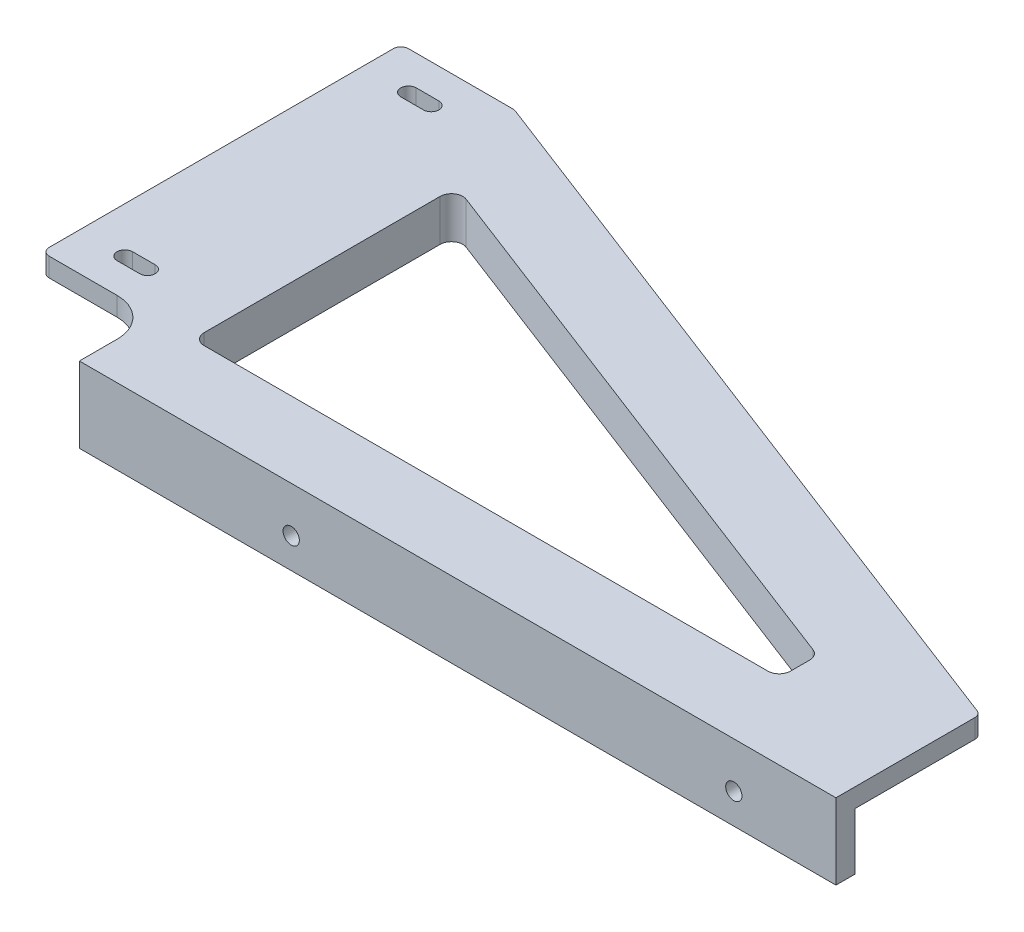
from build123d import *

# Parameters (mm, degrees)
BOSS_EXTRUDE1_DEPTH = 5
SKETCH2_W           = 200
SKETCH2_H           = 5
BOSS_EXTRUDE2_DEPTH = 15
BOSS_EXTRUDE3_DEPTH = 15
SKETCH6_R           = 2.15
CUT_EXTRUDE2_DEPTH  = 175.212513902
CUT_EXTRUDE3_DEPTH  = 3.2
SKETCH9_W           = 20
SKETCH9_H           = 11
BOSS_EXTRUDE4_DEPTH = 2
CHAMFER1_SIZE       = 2
CUT_EXTRUDE4_DEPTH  = 175.051716452
CUT_EXTRUDE5_DEPTH  = 175.212513902
BOSS_EXTRUDE5_START = 6
BOSS_EXTRUDE5_DEPTH = 6
FILLET1_R           = 2


with BuildPart() as part:
    # Sketch1 → Boss-Extrude1 (new body)
    with BuildSketch(Plane(origin=(0, 0, 0), x_dir=(1, 0, 0), z_dir=(0, 1, 0))):
        with BuildLine():
            Line((-100, 0), (100, 0))
            Line((100, 0), (100, 38.1))
            Line((100, 38.1), (-100, 115))
            Line((-100, 115), (-130, 115))
            Line((-130, 115), (-130, 20))
            Line((-130, 20), (-110, 20))
            ThreePointArc((-110, 20), (-102.928932188, 17.071067812), (-100, 10))
            Line((-100, 10), (-100, 0))
        make_face()
    extrude(amount=BOSS_EXTRUDE1_DEPTH)

    # Sketch2 → Boss-Extrude2 (add)
    with BuildSketch(Plane.XZ):
        with Locations((0, -2.5)):
            Rectangle(SKETCH2_W, SKETCH2_H)
    extrude(amount=BOSS_EXTRUDE2_DEPTH)

    # Sketch5 → Boss-Extrude3 (add)
    with BuildSketch(Plane.XZ):
        Polygon((-53.5, -5), (-34.5, -5), (-39.5, -10), (-48.5, -10), align=None)
        Polygon((68.5, -10), (77.5, -10), (82.5, -5), (63.5, -5), align=None)
    extrude(amount=BOSS_EXTRUDE3_DEPTH)

    # Sketch6 → Cut-Extrude2 (cut, through all)
    with BuildSketch(Plane.XY):
        with Locations((-44, -7)):
            Circle(SKETCH6_R)
        with Locations((73, -7)):
            Circle(SKETCH6_R)
    extrude(amount=-CUT_EXTRUDE2_DEPTH, mode=Mode.SUBTRACT)

    # Sketch7 → Cut-Extrude3 (cut)
    with BuildSketch(Plane(origin=(0, 0, -10), x_dir=(-1, 0, 0), z_dir=(0, 0, -1))):
        Polygon((-73, -11.099186911), (-69.45, -9.049593456), (-69.45, -4.950406544), (-73, -2.900813089), (-76.55, -4.950406544), (-76.55, -9.049593456), align=None)
        Polygon((47.55, -9.049593456), (47.55, -4.950406544), (44, -2.900813089), (40.45, -4.950406544), (40.45, -9.049593456), (44, -11.099186911), align=None)
    extrude(amount=-CUT_EXTRUDE3_DEPTH, mode=Mode.SUBTRACT)

    # Sketch9 → Boss-Extrude4 (add)
    with BuildSketch(Plane.XZ):
        with Locations((-115, -30)):
            Rectangle(SKETCH9_W, SKETCH9_H)
        with Locations((-115, -105)):
            Rectangle(SKETCH9_W, SKETCH9_H)
    extrude(amount=BOSS_EXTRUDE4_DEPTH)

    # Chamfer1
    chamfer1_edges = [part.edges().sort_by_distance(p)[0] for p in [
        (-105, 0, -30),
        (-115, 0, -35.5),
        (-115, 0, -24.5),
        (-125, 0, -30),
        (-115, 0, -99.5),
        (-125, 0, -105),
        (-105, 0, -105),
        (-115, 0, -110.5),
    ]]
    chamfer(chamfer1_edges, length=CHAMFER1_SIZE - 0.0001)  # a hair under: the kernel refuses the full size

    # Sketch8 → Cut-Extrude4 (cut, through all)
    with BuildSketch(Plane.XZ.offset(2)):
        with BuildLine():
            Line((-118, -27.95), (-112, -27.95))
            ThreePointArc((-112, -27.95), (-109.95, -30), (-112, -32.05))
            Line((-112, -32.05), (-118, -32.05))
            ThreePointArc((-118, -32.05), (-120.05, -30), (-118, -27.95))
        make_face()
        with BuildLine():
            Line((-118, -102.95), (-112, -102.95))
            ThreePointArc((-112, -102.95), (-109.95, -105), (-112, -107.05))
            Line((-112, -107.05), (-118, -107.05))
            ThreePointArc((-118, -107.05), (-120.05, -105), (-118, -102.95))
        make_face()
    extrude(amount=-CUT_EXTRUDE4_DEPTH, mode=Mode.SUBTRACT)

    # Sketch10 → Cut-Extrude5 (cut, through all)
    with BuildSketch(Plane.XZ):
        with BuildLine():
            Line((-90, -31.398310884), (-90, -85.359919445))
            ThreePointArc((-90, -85.359919445), (-88.698533585, -87.832768745), (-85.923344225, -88.160064502))
            Line((-85.923344225, -88.160064502), (63.076655775, -30.869564502))
            ThreePointArc((63.076655775, -30.869564502), (64.4728493, -29.76795303), (65, -28.069419445))
            Line((65, -28.069419445), (65, -23))
            ThreePointArc((65, -23), (64.121320344, -20.878679656), (62, -20))
            Line((62, -20), (-87, -20))
            ThreePointArc((-87, -20), (-89.121320344, -20.878679656), (-90, -23))
            Line((-90, -23), (-90, -31.398310884))
        make_face()
    extrude(amount=-CUT_EXTRUDE5_DEPTH, mode=Mode.SUBTRACT)

    # Sketch11 → Boss-Extrude5 (add)
    with BuildSketch(Plane.XZ.offset(BOSS_EXTRUDE5_START)):
        with BuildLine():
            Line((62, -17.75), (-87, -17.75))
            ThreePointArc((-87, -17.75), (-90.712310601, -19.287689399), (-92.25, -23))
            Line((-92.25, -23), (-92.25, -85.359919445))
            ThreePointArc((-92.25, -85.359919445), (-89.972433773, -89.68740572), (-85.115852394, -90.260173296))
            Line((-85.115852394, -90.260173296), (63.884147606, -32.969673296))
            ThreePointArc((63.884147606, -32.969673296), (66.327486275, -31.041853218), (67.25, -28.069419445))
            Line((67.25, -28.069419445), (67.25, -23))
            ThreePointArc((67.25, -23), (65.712310601, -19.287689399), (62, -17.75))
        make_face()
        with BuildLine():
            Line((-90, -23), (-90, -85.359919445))
            ThreePointArc((-90, -85.359919445), (-88.698533585, -87.832768745), (-85.923344225, -88.160064502))
            Line((-85.923344225, -88.160064502), (63.076655775, -30.869564502))
            ThreePointArc((63.076655775, -30.869564502), (64.4728493, -29.76795303), (65, -28.069419445))
            Line((65, -28.069419445), (65, -23))
            ThreePointArc((65, -23), (64.121320344, -20.878679656), (62, -20))
            Line((62, -20), (-87, -20))
            ThreePointArc((-87, -20), (-89.121320344, -20.878679656), (-90, -23))
        make_face(mode=Mode.SUBTRACT)
    extrude(amount=-BOSS_EXTRUDE5_DEPTH)

    # Fillet1
    fillet1_edges = [part.edges().sort_by_distance(p)[0] for p in [
        (-130, 2.5, -115),
        (-130, 2.5, -20),
        (100, 2.5, -38.1),
        (-100, 2.5, -115),
    ]]
    fillet(fillet1_edges, radius=FILLET1_R)


solid = part.part
